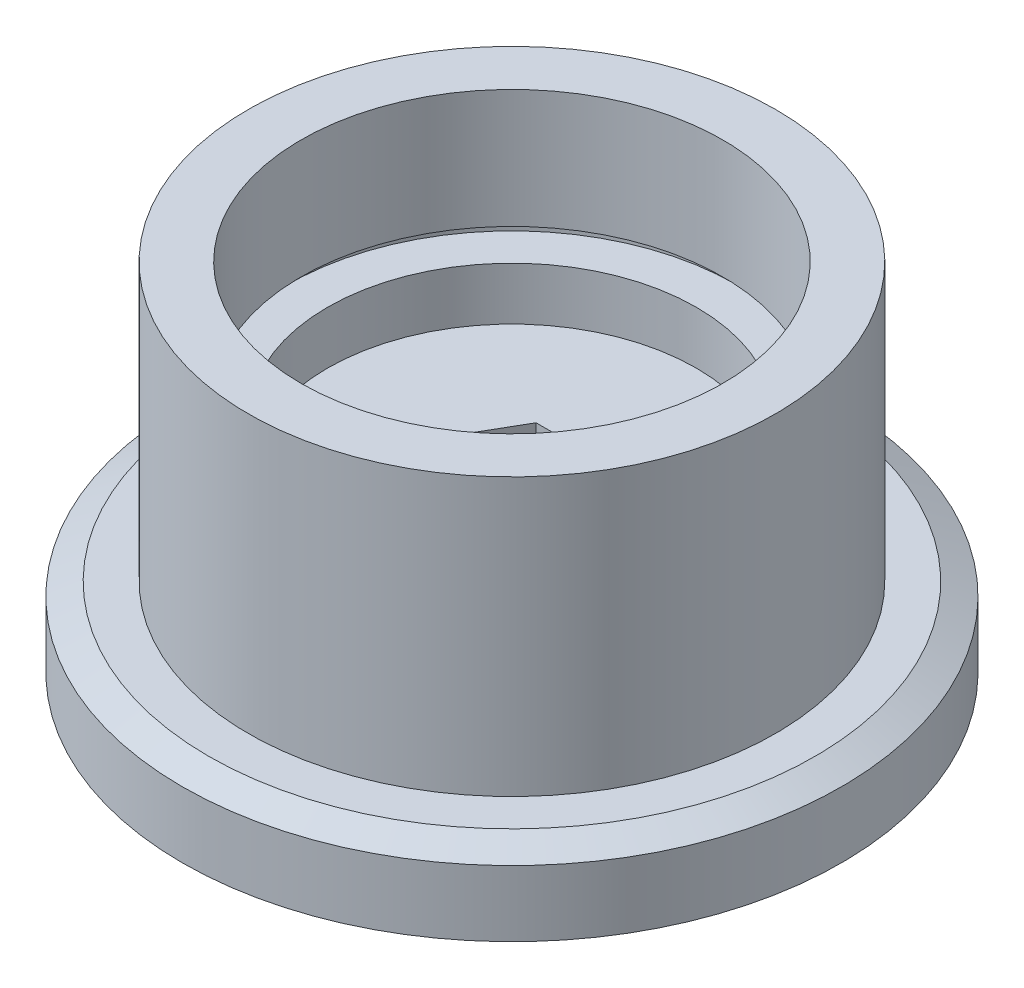
from build123d import *

# Parameters (mm, degrees)
ESQUISSE1_R             = 12.5
BOSS_EXTRU_1_DEPTH      = 3.5
ESQUISSE2_R             = 10
BOSS_EXTRU_2_DEPTH      = 10.5
ESQUISSE6_R             = 8
ENL_V_MAT_EXTRU_1_DEPTH = 4.5
ESQUISSE5_R             = 8.5
ENL_V_MAT_EXTRU_3_DEPTH = 0.5
ESQUISSE4_R             = 7
ENL_V_MAT_EXTRU_2_DEPTH = 2
CHANFREIN1_SIZE         = 0.5
CHANFREIN1_SIZE2        = 1
CHANFREIN2_SIZE         = 1
CHANFREIN2_SIZE2        = 0.5
CUT_EXTRUDE1_DEPTH      = 7


with BuildPart() as part:
    # Esquisse1 → Boss.-Extru.1 (new body)
    with BuildSketch(Plane(origin=(0, 0, 0), x_dir=(1, 0, 0), z_dir=(0, 1, 0))):
        Circle(ESQUISSE1_R)
    extrude(amount=BOSS_EXTRU_1_DEPTH)

    # Esquisse2 → Boss.-Extru.2 (add)
    with BuildSketch(Plane(origin=(0, 3.5, 0), x_dir=(1, 0, 0), z_dir=(0, 1, 0))):
        Circle(ESQUISSE2_R)
    extrude(amount=BOSS_EXTRU_2_DEPTH)

    # Esquisse6 → Enlèv. mat.-Extru.1 (cut)
    with BuildSketch(Plane(origin=(0, 14, 0), x_dir=(1, 0, 0), z_dir=(0, 1, 0))):
        Circle(ESQUISSE6_R)
    extrude(amount=-ENL_V_MAT_EXTRU_1_DEPTH, mode=Mode.SUBTRACT)

    # Esquisse5 → Enlèv. mat.-Extru.3 (cut)
    with BuildSketch(Plane.XZ.offset(-9.5)):
        Circle(ESQUISSE5_R)
    extrude(amount=ENL_V_MAT_EXTRU_3_DEPTH, mode=Mode.SUBTRACT)

    # Esquisse4 → Enlèv. mat.-Extru.2 (cut)
    with BuildSketch(Plane.XZ.offset(-9)):
        Circle(ESQUISSE4_R)
    extrude(amount=ENL_V_MAT_EXTRU_2_DEPTH, mode=Mode.SUBTRACT)

    # Chanfrein1
    chanfrein1_edges = [part.edges().sort_by_distance(p)[0] for p in [
        (-12.5, 3.5, 0),
    ]]
    chanfrein1_side = [part.faces().sort_by_distance(p)[0] for p in [
        (-12.5, 1.75, 0),
    ]]
    chamfer(chanfrein1_edges, length=CHANFREIN1_SIZE, length2=CHANFREIN1_SIZE2, reference=chanfrein1_side[0])

    # Chanfrein2
    chanfrein2_edges = [part.edges().sort_by_distance(p)[0] for p in [
        (-12.5, 0, 0),
    ]]
    chanfrein2_side = [part.faces().sort_by_distance(p)[0] for p in [
        (0, 0, 0),
    ]]
    chamfer(chanfrein2_edges, length=CHANFREIN2_SIZE, length2=CHANFREIN2_SIZE2, reference=chanfrein2_side[0])

    # Sketch1 → Cut-Extrude1 (cut)
    with BuildSketch(Plane.XZ):
        Polygon((2.5, 0), (1.25, 2.165063509), (-1.25, 2.165063509), (-2.5, 0), (-1.25, -2.165063509), (1.25, -2.165063509), align=None)
    extrude(amount=-CUT_EXTRUDE1_DEPTH, mode=Mode.SUBTRACT)


solid = part.part
